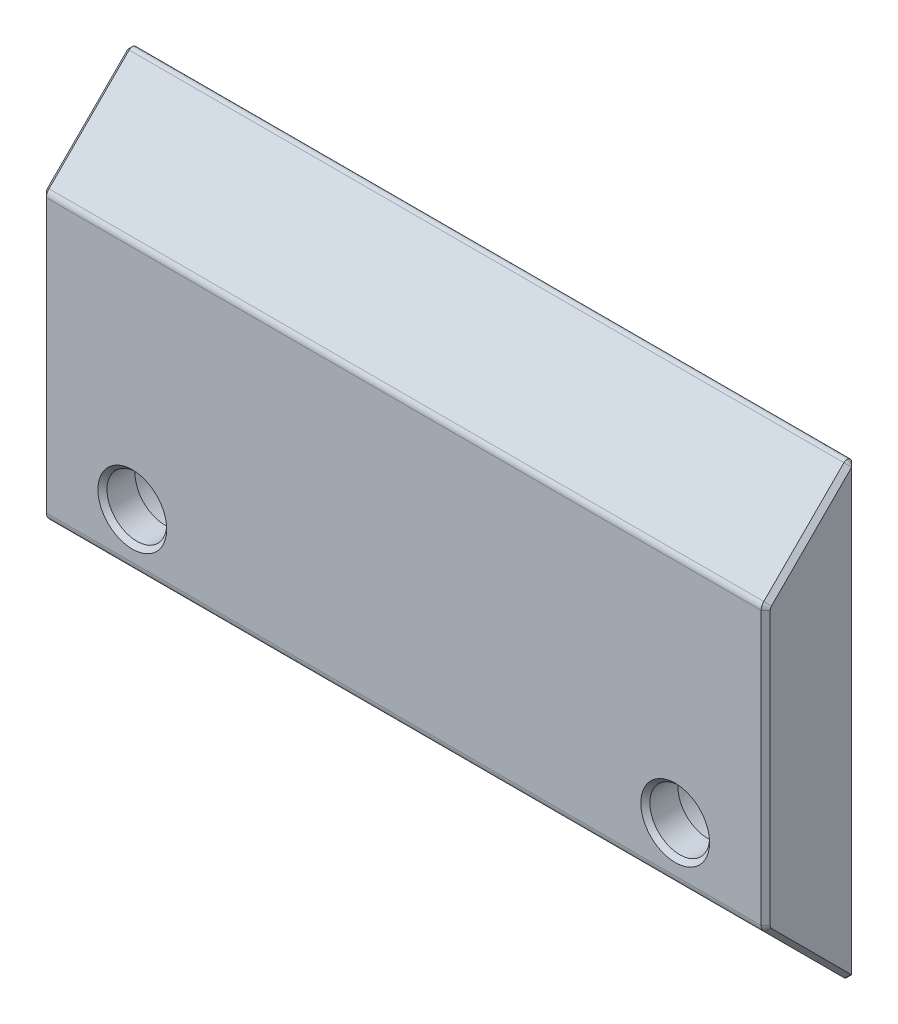
from build123d import *

# Parameters (mm, degrees)
BOSS_EXTRUDE1_DEPTH                                 = 80
CBORE_FOR_M6_HEX_SOCKET_HEAD_CAP_SCREW1_D           = 6.6
CBORE_FOR_M6_HEX_SOCKET_HEAD_CAP_SCREW1_CBORE_D     = 11
CBORE_FOR_M6_HEX_SOCKET_HEAD_CAP_SCREW1_CBORE_DEPTH = 6.4
FILLET1_R                                           = 0.5
FILLET2_R                                           = 1
CHAMFER1_SIZE                                       = 0.5
CHAMFER2_SIZE                                       = 0.5


with BuildPart() as part:
    # Sketch2 → Boss-Extrude1 (new body)
    with BuildSketch(Plane(origin=(0, 0, 0), x_dir=(0, 0, -1), z_dir=(1, 0, 0))):
        Polygon((0, 0), (0, 51), (-10, 41), (-10, 10), align=None)
    extrude(amount=BOSS_EXTRUDE1_DEPTH)

    # CBORE for M6 Hex Socket Head Cap Screw1 (through all)
    with Locations(Plane(origin=(0, 0, 0), x_dir=(-1, 0, 0), z_dir=(0, 0, -1))):
        with Locations((-70, 15.5), (-10, 15.5)):
            CounterBoreHole(CBORE_FOR_M6_HEX_SOCKET_HEAD_CAP_SCREW1_D / 2, CBORE_FOR_M6_HEX_SOCKET_HEAD_CAP_SCREW1_CBORE_D / 2, CBORE_FOR_M6_HEX_SOCKET_HEAD_CAP_SCREW1_CBORE_DEPTH)

    # Fillet1
    fillet1_edges = [part.edges().sort_by_distance(p)[0] for p in [
        (40, 51, 0),
        (40, 0, 0),
    ]]
    fillet(fillet1_edges, radius=FILLET1_R)

    # Fillet2
    fillet2_edges = [part.edges().sort_by_distance(p)[0] for p in [
        (40, 41, 10),
        (40, 10, 10),
    ]]
    fillet(fillet2_edges, radius=FILLET2_R)

    # Chamfer1
    chamfer1_edges = [part.edges().sort_by_distance(p)[0] for p in [
        (0, 10.03153013, 9.923879533),
        (0, 5.280330086, 5.280330086),
        (0, 0.745167015, 0.308658284),
        (0, 25.5, 0),
        (0, 50.254832985, 0.308658284),
        (0, 45.719669914, 5.280330086),
        (0, 40.96846987, 9.923879533),
        (0, 25.5, 10),
        (80, 50.254832985, 0.308658284),
        (80, 25.5, 0),
        (80, 0.745167015, 0.308658284),
        (80, 5.280330086, 5.280330086),
        (80, 10.03153013, 9.923879533),
        (80, 25.5, 10),
        (80, 40.96846987, 9.923879533),
        (80, 45.719669914, 5.280330086),
        (6.7, 15.5, 10),
        (66.7, 15.5, 10),
    ]]
    chamfer(chamfer1_edges, length=CHAMFER1_SIZE)

    # Chamfer2
    chamfer2_edges = [part.edges().sort_by_distance(p)[0] for p in [
        (75.5, 15.5, 0),
        (15.5, 15.5, 0),
    ]]
    chamfer(chamfer2_edges, length=CHAMFER2_SIZE)


solid = part.part
